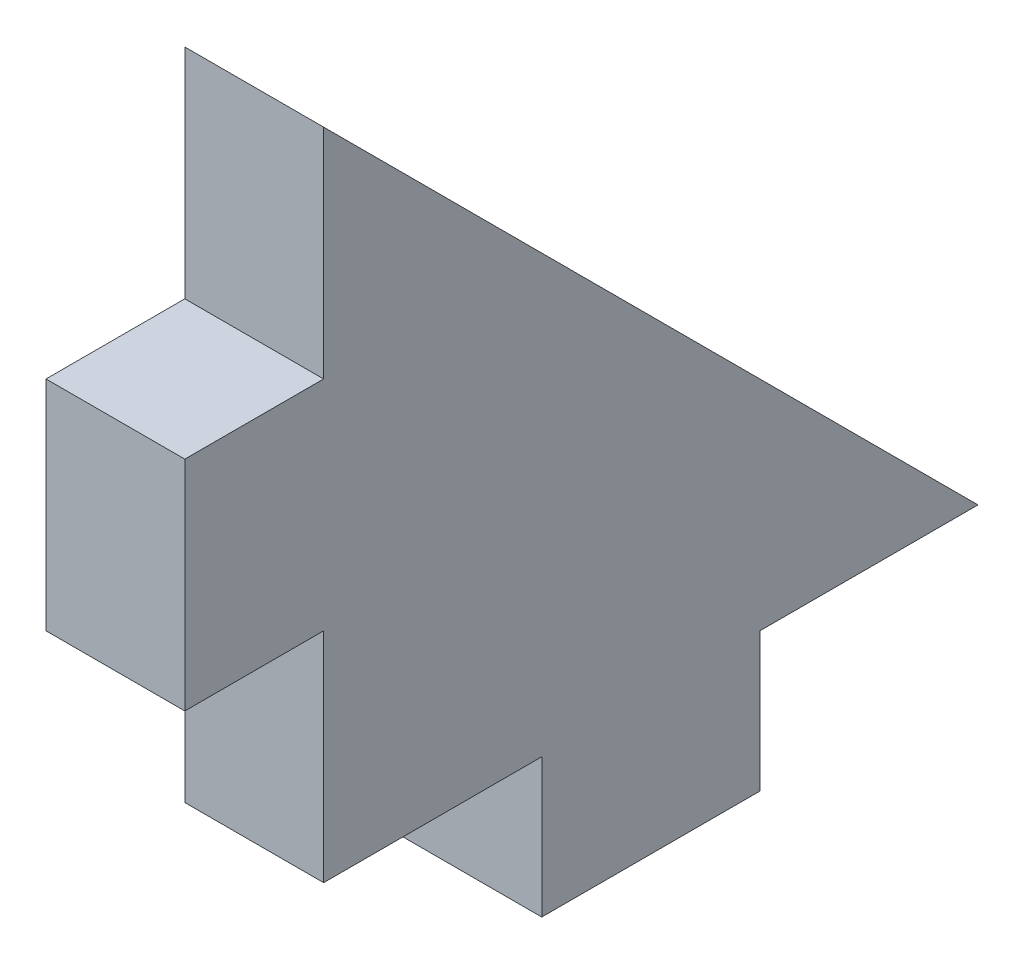
from build123d import *

# Parameters (mm, degrees)
BOSS_EXTRUDE1_DEPTH = 4.5


with BuildPart() as part:
    # Sketch1 → Boss-Extrude1 (new body)
    with BuildSketch(Plane(origin=(0, 0, 0), x_dir=(0, 0, -1), z_dir=(1, 0, 0))):
        Polygon((0, 21.213203436), (21.213203436, 0), (14.142135624, 0), (14.142135624, -4.5), (7.071067812, -4.5), (7.071067812, 0), (0, 0), (0, 7.071067812), (-4.5, 7.071067812), (-4.5, 14.142135624), (0, 14.142135624), align=None)
    extrude(amount=BOSS_EXTRUDE1_DEPTH)


solid = part.part
